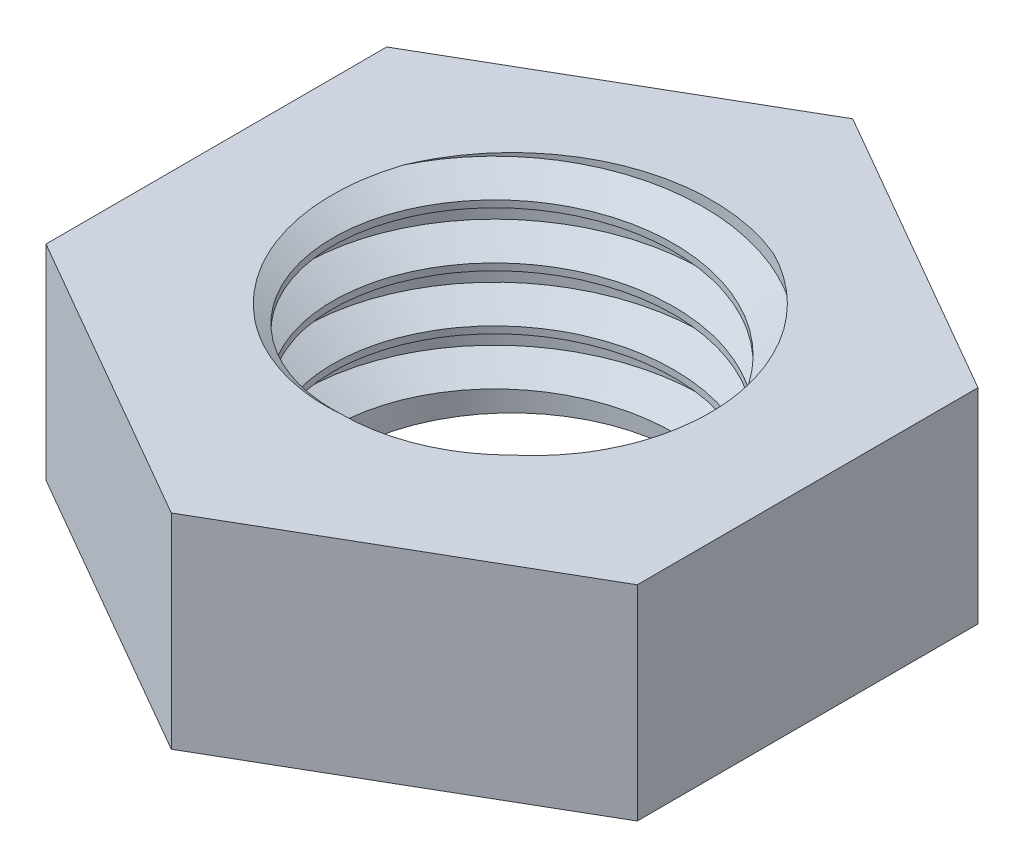
from build123d import *

# Parameters (mm, degrees)
SKETCH1_R           = 12.5
BOSS_EXTRUDE1_DEPTH = 15
THREAD1_PITCH       = 4


with BuildPart() as part:
    # Sketch1 → Boss-Extrude1 (new body)
    with BuildSketch(Plane(origin=(0, 0, 0), x_dir=(1, 0, 0), z_dir=(0, 1, 0))):
        Polygon((21.662475399, -12.479469523), (21.638775333, 12.520519243), (-0.023700067, 24.999988766), (-21.662475399, 12.479469523), (-21.638775333, -12.520519243), (0.023700067, -24.999988766), align=None)
        with Locations(Location((0, 0, 0), (0, 0, 270))):
            Circle(SKETCH1_R, mode=Mode.SUBTRACT)
    extrude(amount=BOSS_EXTRUDE1_DEPTH)

    # Thread1: the profile of Thread Profile2 profile screwed along a right-hand helix of 3.75 turns, 12 arcs to a turn; built about Z, then put on its axis
    thread1_z = Axis((0, 0, 0), (0, 0, 1))
    thread1_corners = [(12.4997, 0, -0.000173205), (12.4997, 0, 3.500173194), (14.6650635, 0, 2.249999995), (14.6650635, 0, 1.249999995)]
    with BuildLine(mode=Mode.PRIVATE) as thread1_profile:
        Line(thread1_corners[0], thread1_corners[1])
        Line(thread1_corners[1], thread1_corners[2])
        Line(thread1_corners[2], thread1_corners[3])
        Line(thread1_corners[3], thread1_corners[0])
    thread1_cap = Face(thread1_profile.wire())
    thread1_turn_angles = [0, 15, 30, 45, 60, 75, 90, 105, 120, 135, 150, 165, 180, 195, 210, 225, 240, 255, 270, 285, 300, 315, 330, 345, 360]
    thread1_turn_weights = [1, 0.9659258262890683, 1, 0.9659258262890683, 1, 0.9659258262890683, 1, 0.9659258262890683, 1, 0.9659258262890683, 1, 0.9659258262890683, 1, 0.9659258262890683, 1, 0.9659258262890683, 1, 0.9659258262890683, 1, 0.9659258262890683, 1, 0.9659258262890683, 1, 0.9659258262890683, 1]
    thread1_turn_rails = [Edge.make_bspline([Vector(p[0], p[1], 0).rotate(thread1_z, thread1_turn_angles[k]) / thread1_turn_weights[k] + Vector(0, 0, p[2] + THREAD1_PITCH * thread1_turn_angles[k] / 360) for k in range(25)], [0, 0, 0, 1, 1, 2, 2, 3, 3, 4, 4, 5, 5, 6, 6, 7, 7, 8, 8, 9, 9, 10, 10, 11, 11, 12, 12, 12], 2, thread1_turn_weights) for p in thread1_corners]
    thread1_turn_sides = [Face.make_surface_from_curves(thread1_turn_rails[p[0]], thread1_turn_rails[p[1]]) for p in [(0, 1), (1, 2), (2, 3), (3, 0)]]
    thread1_last_angles = [1080, 1095, 1110, 1125, 1140, 1155, 1170, 1185, 1200, 1215, 1230, 1245, 1260, 1275, 1290, 1305, 1320, 1335, 1350]
    thread1_last_weights = [1, 0.9659258262890683, 1, 0.9659258262890683, 1, 0.9659258262890683, 1, 0.9659258262890683, 1, 0.9659258262890683, 1, 0.9659258262890683, 1, 0.9659258262890683, 1, 0.9659258262890683, 1, 0.9659258262890683, 1]
    thread1_last_rails = [Edge.make_bspline([Vector(p[0], p[1], 0).rotate(thread1_z, thread1_last_angles[k]) / thread1_last_weights[k] + Vector(0, 0, p[2] + THREAD1_PITCH * thread1_last_angles[k] / 360) for k in range(19)], [0, 0, 0, 1, 1, 2, 2, 3, 3, 4, 4, 5, 5, 6, 6, 7, 7, 8, 8, 9, 9, 9], 2, thread1_last_weights) for p in thread1_corners]
    thread1_last_sides = [Face.make_surface_from_curves(thread1_last_rails[p[0]], thread1_last_rails[p[1]]) for p in [(0, 1), (1, 2), (2, 3), (3, 0)]]
    thread1 = Plane(origin=(0, 0, 0), x_dir=(1, 0, 0), z_dir=(0, 1, 0)) * Solid(Shell([*[p.moved(Location((0, 0, THREAD1_PITCH * i))) for i in range(3) for p in thread1_turn_sides], *thread1_last_sides, thread1_cap, thread1_cap.rotate(thread1_z, 1350).moved(Location((0, 0, THREAD1_PITCH * 1350 / 360)))]))
    add(thread1, mode=Mode.SUBTRACT)


solid = part.part
